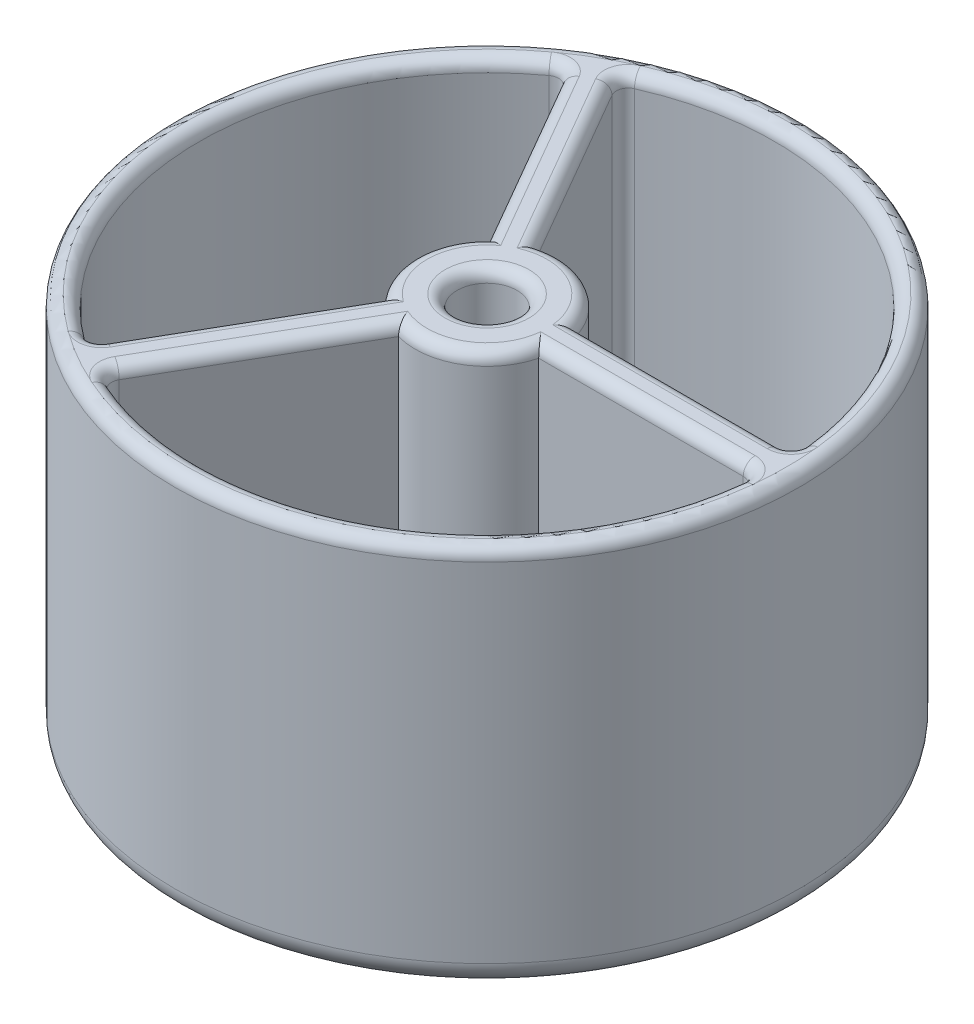
from build123d import *

# Parameters (mm, degrees)
SKETCH1_R           = 13
BOSS_EXTRUDE1_DEPTH = 16
SKETCH2_R           = 12
CUT_EXTRUDE1_DEPTH  = 15
SKETCH3_R           = 3
SKETCH3_R_2         = 1.25
BOSS_EXTRUDE3_DEPTH = 15
BOSS_EXTRUDE4_START = 15
BOSS_EXTRUDE4_DEPTH = 15
FILLET4_R           = 0.5
FILLET8_R           = 0.5
FILLET9_R           = 0.5
FILLET10_R          = 1


with BuildPart() as part:
    # Sketch1 → Boss-Extrude1 (new body)
    with BuildSketch(Plane(origin=(0, 0, 0), x_dir=(1, 0, 0), z_dir=(0, 1, 0))):
        with Locations(Location((0, 0, 0), (0, 0, 270))):
            Circle(SKETCH1_R)
    extrude(amount=BOSS_EXTRUDE1_DEPTH)

    # Sketch2 → Cut-Extrude1 (cut)
    with BuildSketch(Plane(origin=(0, 16, 0), x_dir=(1, 0, 0), z_dir=(0, 1, 0))):
        with Locations(Location((0, 0, 0), (0, 0, 270))):
            Circle(SKETCH2_R)
    extrude(amount=-CUT_EXTRUDE1_DEPTH, mode=Mode.SUBTRACT)

    # Sketch3 → Boss-Extrude3 (add)
    with BuildSketch(Plane(origin=(0, 1.0000000000000009, 0), x_dir=(1, 0, 0), z_dir=(0, 1, 0))):
        with Locations(Location((0, 0, 0), (0, 0, 270))):
            Circle(SKETCH3_R)
        with Locations(Location((0, 0, 0), (0, 0, 270))):
            Circle(SKETCH3_R_2, mode=Mode.SUBTRACT)
    extrude(amount=BOSS_EXTRUDE3_DEPTH)

    # Sketch5 → Boss-Extrude4 (add)
    with BuildSketch(Plane(origin=(0, 1.0000000000000009, 0), x_dir=(1, 0, 0), z_dir=(0, 1, 0)).offset(BOSS_EXTRUDE4_START)):
        with BuildLine():
            Line((-1.9485571585149906, -1.8750000000000073), (-6.637788836339994, -9.99698751445455))
            ThreePointArc((-6.637788836339994, -9.99698751445455), (-5.999999999999962, -10.392304845413287), (-5.338750730663418, -10.746987514454501))
            Line((-5.338750730663418, -10.746987514454501), (-0.6495190528383291, -2.6249999999999987))
            Line((-0.6495190528383291, -2.6249999999999987), (-1.9485571585149906, -1.8750000000000073))
        make_face()
        with BuildLine():
            Line((2.5980762113533236, -0.75), (11.976539567003487, -0.75))
            ThreePointArc((11.976539567003487, -0.75), (12.000000000000002, 0), (11.976539567003487, 0.75))
            Line((11.976539567003487, 0.75), (2.5980762113533102, 0.75))
            Line((2.5980762113533102, 0.75), (2.5980762113533236, -0.75))
        make_face()
        with BuildLine():
            Line((-0.6495190528383203, 2.6249999999999893), (-5.3387507306632696, 10.746987514454572))
            ThreePointArc((-5.3387507306632696, 10.746987514454572), (-5.999999999999985, 10.392304845413275), (-6.637788836340183, 9.996987514454428))
            Line((-6.637788836340183, 9.996987514454428), (-1.9485571585149792, 1.8749999999999911))
            Line((-1.9485571585149792, 1.8749999999999911), (-0.6495190528383203, 2.6249999999999893))
        make_face()
    extrude(amount=-BOSS_EXTRUDE4_DEPTH)

    # Fillet4
    fillet4_edges = [part.edges().sort_by_distance(p)[0] for p in [
        (-5.338750730663417, 8.5, 10.746987514454503),
        (-6.637788836339995, 8.5, 9.99698751445455),
        (11.976539567003487, 8.5, -0.7499999999999999),
        (11.976539567003487, 8.5, 0.75),
        (-6.637788836340183, 8.5, -9.996987514454428),
        (-5.3387507306632696, 8.5, -10.746987514454574),
    ]]
    fillet(fillet4_edges, radius=FILLET4_R)

    # Fillet8
    fillet8_edges = [part.edges().sort_by_distance(p)[0] for p in [
        (-6.695532692704444, 16, -9.764574656753775),
        (11.804136056250712, 16, 0.9162140753742581),
        (-6.695532692704263, 16, 9.764574656753897),
        (-5.108603363546381, 16, 10.680788732128102),
        (3.8e-16, 16, -1.25),
        (1.4999999999999452, 16, 2.598076211353348),
        (-2.9346311658689803, 16, 6.582930280760159),
        (-4.2336692715456055, 16, 5.8329302807601975),
        (1.4999999999999785, 16, -2.5980762113533284),
        (7.168300437414603, 16, -0.75),
        (7.168300437414587, 16, 0.75),
        (3.98e-15, 16, -13),
        (-3, 16, -1.1e-15),
        (-4.233669271545697, 16, -5.83293028076014),
        (-2.9346311658689084, 16, -6.5829302807601975),
        (6.000000000000071, 16, -10.392304845413223),
        (-12, 16, 1.0217e-13),
        (5.999999999999999, 16, 10.392304845413266),
        (-5.108603363546235, 16, -10.680788732128176),
        (11.804136056250712, 16, -0.9162140753742588),
    ]]
    fillet(fillet8_edges, radius=FILLET8_R - 0.0001)  # a hair under: the kernel refuses the full size

    # Fillet9
    fillet9_edges = [part.edges().sort_by_distance(p)[0] for p in [
        (1.4999999999999454, 1.0000000000000009, 2.5980762113533475),
        (-4.2336692715456055, 1.0000000000000009, 5.8329302807601975),
        (-2.9346311658689803, 1.0000000000000009, 6.582930280760159),
        (1.4999999999999785, 1.0000000000000009, -2.5980762113533284),
        (7.168300437414587, 1.0000000000000009, 0.75),
        (7.168300437414603, 1.0000000000000009, -0.75),
        (-3, 1.0000000000000009, 1.56e-15),
        (-2.9346311658689084, 1.0000000000000009, -6.5829302807601975),
        (-4.233669271545697, 1.0000000000000009, -5.832930280760139),
        (6.000000000000071, 1, -10.392304845413223),
        (11.804136056250712, 1, -0.9162140753742588),
        (-5.108603363546235, 1, -10.680788732128176),
        (-12, 1, 1.0217e-13),
        (-6.695532692704263, 1, 9.764574656753897),
        (-6.695532692704444, 1, -9.764574656753775),
        (5.999999999999999, 1.0000000000000004, 10.392304845413266),
        (-5.108603363546381, 1, 10.680788732128102),
        (11.804136056250712, 1, 0.9162140753742581),
    ]]
    fillet(fillet9_edges, radius=FILLET9_R)

    # Fillet10
    fillet10_edges = [part.edges().sort_by_distance(p)[0] for p in [
        (-1.79e-15, 0, -13),
    ]]
    fillet(fillet10_edges, radius=FILLET10_R)


solid = part.part
